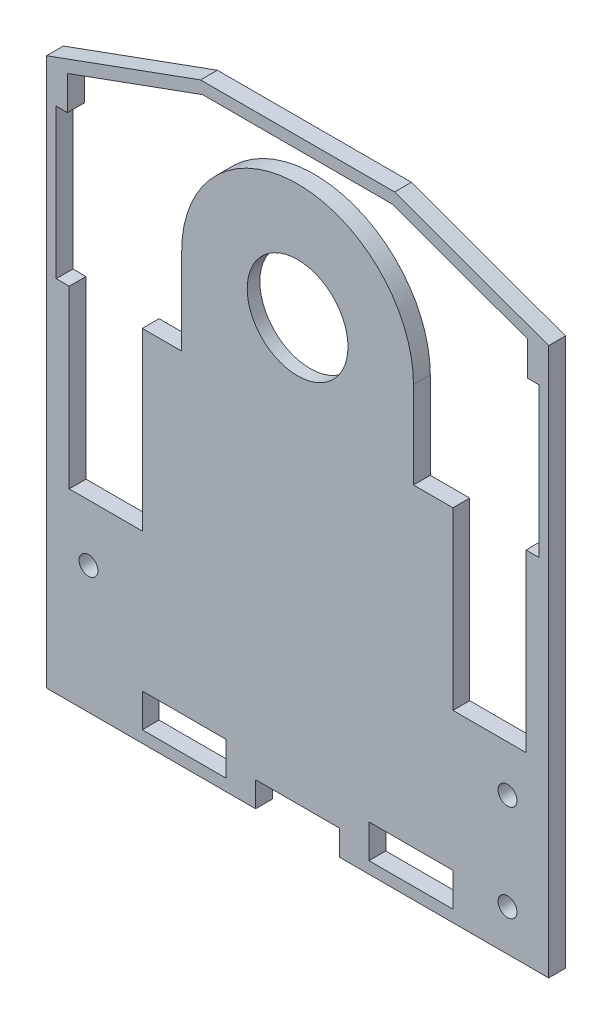
from build123d import *

# Parameters (mm, degrees)
SKETCH1_W           = 10
SKETCH1_H           = 4
SKETCH1_R           = 6
BOSS_EXTRUDE1_DEPTH = 2
SKETCH2_R           = 12.875
CUT_EXTRUDE1_DEPTH  = 0.5
SKETCH3_R           = 1.125
CUT_EXTRUDE2_DEPTH  = 59.651581376
SKETCH4_W           = 10
SKETCH4_H           = 3
CUT_EXTRUDE3_DEPTH  = 59.651581376


with BuildPart() as part:
    # Sketch1 → Boss-Extrude1 (new body)
    with BuildSketch(Plane.XY.offset(-369.35631811)):
        Polygon((32.867749828, 41.859703988), (14.52546441, 48.535749909), (-8.589964754, 48.535749909), (-26.932250172, 41.859703988), (-26.932250172, -23.364250091), (32.867749828, -23.364250091), align=None)
        with BuildLine():
            Line((-24.432250172, 37.235749909), (-24.432250172, 41.279780692))
            Line((-24.432250172, 41.279780692), (-8.343106981, 47.135749909))
            Line((-8.343106981, 47.135749909), (14.278606637, 47.135749909))
            Line((14.278606637, 47.135749909), (30.367749828, 41.279780692))
            Line((30.367749828, 41.279780692), (30.367749828, 37.235749909))
            Line((30.367749828, 37.235749909), (31.717749828, 37.235749909))
            Line((31.717749828, 37.235749909), (31.717749828, 19.435749909))
            Line((31.717749828, 19.435749909), (30.167749828, 19.435749909))
            Line((30.167749828, 19.435749909), (30.167749828, -1.464250091))
            Line((30.167749828, -1.464250091), (21.467749828, -1.464250091))
            Line((21.467749828, -1.464250091), (21.467749828, 19.435749909))
            Line((21.467749828, 19.435749909), (16.767749828, 19.435749909))
            Line((16.767749828, 19.435749909), (16.767749828, 29.785749909))
            ThreePointArc((16.767749828, 29.785749909), (2.967749828, 43.585749909), (-10.832250172, 29.785749909))
            Line((-10.832250172, 29.785749909), (-10.832250172, 19.435749909))
            Line((-10.832250172, 19.435749909), (-15.532250172, 19.435749909))
            Line((-15.532250172, 19.435749909), (-15.532250172, -1.464250091))
            Line((-15.532250172, -1.464250091), (-24.232250172, -1.464250091))
            Line((-24.232250172, -1.464250091), (-24.232250172, 19.435749909))
            Line((-24.232250172, 19.435749909), (-25.782250172, 19.435749909))
            Line((-25.782250172, 19.435749909), (-25.782250172, 37.235749909))
            Line((-25.782250172, 37.235749909), (-24.432250172, 37.235749909))
        make_face(mode=Mode.SUBTRACT)
        with Locations((-10.532250172, -19.964250091)):
            Rectangle(SKETCH1_W, SKETCH1_H, mode=Mode.SUBTRACT)
        with Locations((16.467749828, -19.964250091)):
            Rectangle(SKETCH1_W, SKETCH1_H, mode=Mode.SUBTRACT)
        with Locations((2.967749828, 29.785749909)):
            Circle(SKETCH1_R, mode=Mode.SUBTRACT)
    extrude(amount=BOSS_EXTRUDE1_DEPTH)

    # Sketch2 → Cut-Extrude1 (cut)
    with BuildSketch(Plane(origin=(0, 0, -369.35631811), x_dir=(-1, 0, 0), z_dir=(0, 0, -1))):
        with Locations((-2.967749828, 29.785749909)):
            Circle(SKETCH2_R)
    extrude(amount=-CUT_EXTRUDE1_DEPTH, mode=Mode.SUBTRACT)

    # Sketch3 → Cut-Extrude2 (cut, through all)
    with BuildSketch(Plane.XY.offset(-367.35631811)):
        with Locations((27.967749828, -6.964250091)):
            Circle(SKETCH3_R)
        with Locations((27.967749828, -18.464250091)):
            Circle(SKETCH3_R)
        with Locations((-21.932250172, -8.214250091)):
            Circle(SKETCH3_R)
    extrude(amount=-CUT_EXTRUDE2_DEPTH, mode=Mode.SUBTRACT)

    # Sketch4 → Cut-Extrude3 (cut, through all)
    with BuildSketch(Plane.XY.offset(-367.35631811)):
        with Locations((2.967749828, -21.864250091)):
            Rectangle(SKETCH4_W, SKETCH4_H)
    extrude(amount=-CUT_EXTRUDE3_DEPTH, mode=Mode.SUBTRACT)


solid = part.part
